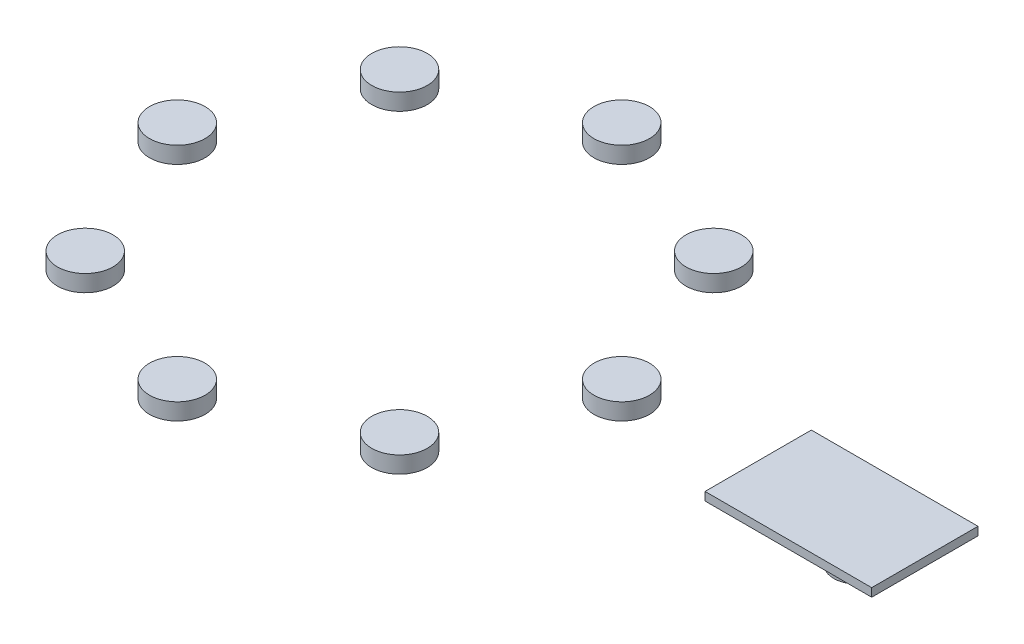
from build123d import *

# Parameters (mm, degrees)
SKETCH1_W             = 15
SKETCH1_H             = 9.566733068
BOSS_EXTRUDE3_DEPTH   = 1.5
SKETCH1_R             = 2.5
BOSS_EXTRUDE3_2_DEPTH = 1.5
BOSS_EXTRUDE3_3_DEPTH = 1.5
BOSS_EXTRUDE3_4_DEPTH = 1.5
BOSS_EXTRUDE3_5_DEPTH = 1.5
BOSS_EXTRUDE3_6_DEPTH = 1.5
BOSS_EXTRUDE3_7_DEPTH = 1.5
BOSS_EXTRUDE3_8_DEPTH = 1.5
BOSS_EXTRUDE3_9_DEPTH = 1.5
SKETCH2_W             = 15
SKETCH2_H             = 9.566733068
SKETCH2_R             = 2
CUT_EXTRUDE1_DEPTH    = 0.75


with BuildPart() as part:
    # Sketch1 → Boss-Extrude3 (new body)
    with BuildSketch(Plane(origin=(0, 0, 0), x_dir=(1, 0, 0), z_dir=(0, 1, 0))):
        with Locations((25, -0.216633466)):
            Rectangle(SKETCH1_W, SKETCH1_H)
    extrude(amount=BOSS_EXTRUDE3_DEPTH)

    # Sketch2 → Cut-Extrude1 (cut)
    with BuildSketch(Plane.XZ):
        with Locations((25, 0.216633466)):
            Rectangle(SKETCH2_W, SKETCH2_H)
        with Locations((28.58016658, 2.5)):
            Circle(SKETCH2_R, mode=Mode.SUBTRACT)
        with Locations((21.41983342, -2.066733068)):
            Circle(SKETCH2_R, mode=Mode.SUBTRACT)
    extrude(amount=-CUT_EXTRUDE1_DEPTH, mode=Mode.SUBTRACT)


with BuildPart() as body_2:
    # Sketch1 → Boss-Extrude3 2 (new body)
    with BuildSketch(Plane(origin=(0, 0, 0), x_dir=(1, 0, 0), z_dir=(0, 1, 0))):
        with Locations((-35, 0)):
            Circle(SKETCH1_R)
    extrude(amount=BOSS_EXTRUDE3_2_DEPTH)


with BuildPart() as body_3:
    # Sketch1 → Boss-Extrude3 3 (new body)
    with BuildSketch(Plane(origin=(0, 0, 0), x_dir=(1, 0, 0), z_dir=(0, 1, 0))):
        with Locations((-29.142135624, 14.142135624)):
            Circle(SKETCH1_R)
    extrude(amount=BOSS_EXTRUDE3_3_DEPTH)


with BuildPart() as body_4:
    # Sketch1 → Boss-Extrude3 4 (new body)
    with BuildSketch(Plane(origin=(0, 0, 0), x_dir=(1, 0, 0), z_dir=(0, 1, 0))):
        with Locations((-15, 20)):
            Circle(SKETCH1_R)
    extrude(amount=BOSS_EXTRUDE3_4_DEPTH)


with BuildPart() as body_5:
    # Sketch1 → Boss-Extrude3 5 (new body)
    with BuildSketch(Plane(origin=(0, 0, 0), x_dir=(1, 0, 0), z_dir=(0, 1, 0))):
        with Locations((-0.857864376, 14.142135624)):
            Circle(SKETCH1_R)
    extrude(amount=BOSS_EXTRUDE3_5_DEPTH)


with BuildPart() as body_6:
    # Sketch1 → Boss-Extrude3 6 (new body)
    with BuildSketch(Plane(origin=(0, 0, 0), x_dir=(1, 0, 0), z_dir=(0, 1, 0))):
        with Locations((5, 0)):
            Circle(SKETCH1_R)
    extrude(amount=BOSS_EXTRUDE3_6_DEPTH)


with BuildPart() as body_7:
    # Sketch1 → Boss-Extrude3 7 (new body)
    with BuildSketch(Plane(origin=(0, 0, 0), x_dir=(1, 0, 0), z_dir=(0, 1, 0))):
        with Locations((-0.857864376, -14.142135624)):
            Circle(SKETCH1_R)
    extrude(amount=BOSS_EXTRUDE3_7_DEPTH)


with BuildPart() as body_8:
    # Sketch1 → Boss-Extrude3 8 (new body)
    with BuildSketch(Plane(origin=(0, 0, 0), x_dir=(1, 0, 0), z_dir=(0, 1, 0))):
        with Locations((-15, -20)):
            Circle(SKETCH1_R)
    extrude(amount=BOSS_EXTRUDE3_8_DEPTH)


with BuildPart() as body_9:
    # Sketch1 → Boss-Extrude3 9 (new body)
    with BuildSketch(Plane(origin=(0, 0, 0), x_dir=(1, 0, 0), z_dir=(0, 1, 0))):
        with Locations((-29.142135624, -14.142135624)):
            Circle(SKETCH1_R)
    extrude(amount=BOSS_EXTRUDE3_9_DEPTH)


solid = Compound([part.part, body_2.part, body_3.part, body_4.part, body_5.part, body_6.part, body_7.part, body_8.part, body_9.part])
